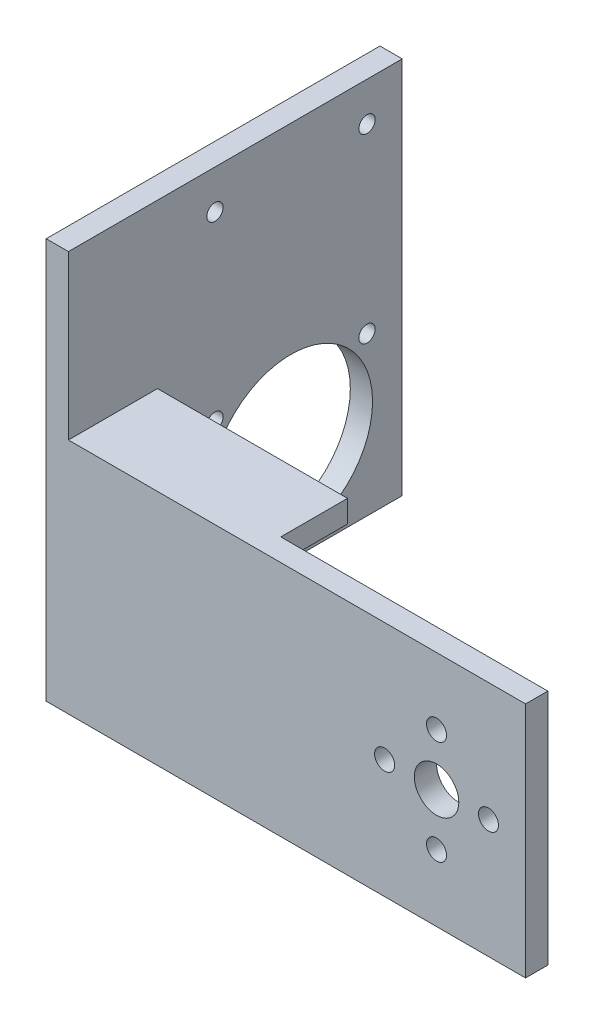
from build123d import *

# Parameters (mm, degrees)
S_BOX1_W      = 64.625
S_BOX1_H      = 32
BOSS_1_DEPTH  = 3
S_BOX2_W      = 3
S_BOX2_H      = 51
BOSS_2_DEPTH  = 45
S_BOX3_W      = 26.125
S_BOX3_H      = 3
BOSS_3_DEPTH  = 11.5
S_BOX4_W      = 26.125
S_BOX4_H      = 3
BOSS_4_DEPTH  = 11.5
S_HOLE5_R     = 3
HOLE_5_DEPTH  = 3.2
S_HOLE6_R     = 1.35
HOLE_6_DEPTH  = 3.2
S_HOLE7_R     = 1.35
HOLE_7_DEPTH  = 3.2
S_HOLE8_R     = 1.35
HOLE_8_DEPTH  = 3.2
S_HOLE9_R     = 1.35
HOLE_9_DEPTH  = 3.2
S_HOLE10_R    = 11
HOLE_10_DEPTH = 3.2
S_HOLE11_R    = 1.1
HOLE_11_DEPTH = 3.2
S_HOLE12_R    = 1.1
HOLE_12_DEPTH = 3.2
S_HOLE13_R    = 1.1
HOLE_13_DEPTH = 3.2
S_HOLE14_R    = 1.1
HOLE_14_DEPTH = 3.2


with BuildPart() as part:
    # S_box1 → Boss_1 (new body)
    with BuildSketch(Plane.XY.offset(27)):
        with Locations((-20.3125, 0)):
            Rectangle(S_BOX1_W, S_BOX1_H)
    extrude(amount=BOSS_1_DEPTH)

    # S_box2 → Boss_2 (add)
    with BuildSketch(Plane.XY.offset(-15)):
        with Locations((-51.125, 12.5)):
            Rectangle(S_BOX2_W, S_BOX2_H)
    extrude(amount=BOSS_2_DEPTH)

    # S_box3 → Boss_3 (add)
    with BuildSketch(Plane.XY.offset(18)):
        with Locations((-37.0625, -12)):
            Rectangle(S_BOX3_W, S_BOX3_H)
    extrude(amount=BOSS_3_DEPTH)

    # S_box4 → Boss_4 (add)
    with BuildSketch(Plane.XY.offset(18)):
        with Locations((-37.0625, 14.5)):
            Rectangle(S_BOX4_W, S_BOX4_H)
    extrude(amount=BOSS_4_DEPTH)

    # S_hole5 → Hole_5 (cut)
    with BuildSketch(Plane.XY.offset(26.9)):
        Circle(S_HOLE5_R)
    extrude(amount=HOLE_5_DEPTH, mode=Mode.SUBTRACT)

    # S_hole6 → Hole_6 (cut)
    with BuildSketch(Plane.XY.offset(26.9)):
        with Locations((7, 0)):
            Circle(S_HOLE6_R)
    extrude(amount=HOLE_6_DEPTH, mode=Mode.SUBTRACT)

    # S_hole7 → Hole_7 (cut)
    with BuildSketch(Plane.XY.offset(26.9)):
        with Locations((0, -7)):
            Circle(S_HOLE7_R)
    extrude(amount=HOLE_7_DEPTH, mode=Mode.SUBTRACT)

    # S_hole8 → Hole_8 (cut)
    with BuildSketch(Plane.XY.offset(26.9)):
        with Locations((-7, 0)):
            Circle(S_HOLE8_R)
    extrude(amount=HOLE_8_DEPTH, mode=Mode.SUBTRACT)

    # S_hole9 → Hole_9 (cut)
    with BuildSketch(Plane.XY.offset(26.9)):
        with Locations((0, 7)):
            Circle(S_HOLE9_R)
    extrude(amount=HOLE_9_DEPTH, mode=Mode.SUBTRACT)

    # S_hole10 → Hole_10 (cut)
    with BuildSketch(Plane(origin=(-52.725, 0, 0), x_dir=(0, 0, -1), z_dir=(1, 0, 0))):
        Circle(S_HOLE10_R)
    extrude(amount=HOLE_10_DEPTH, mode=Mode.SUBTRACT)

    # S_hole11 → Hole_11 (cut)
    with BuildSketch(Plane(origin=(-52.725, 0, 0), x_dir=(0, 0, -1), z_dir=(1, 0, 0))):
        with Locations((10.25, 8.3)):
            Circle(S_HOLE11_R)
    extrude(amount=HOLE_11_DEPTH, mode=Mode.SUBTRACT)

    # S_hole12 → Hole_12 (cut)
    with BuildSketch(Plane(origin=(-52.725, 0, 0), x_dir=(0, 0, -1), z_dir=(1, 0, 0))):
        with Locations((-10.25, 8.3)):
            Circle(S_HOLE12_R)
    extrude(amount=HOLE_12_DEPTH, mode=Mode.SUBTRACT)

    # S_hole13 → Hole_13 (cut)
    with BuildSketch(Plane(origin=(-52.725, 0, 0), x_dir=(0, 0, -1), z_dir=(1, 0, 0))):
        with Locations((10.25, 32.75)):
            Circle(S_HOLE13_R)
    extrude(amount=HOLE_13_DEPTH, mode=Mode.SUBTRACT)

    # S_hole14 → Hole_14 (cut)
    with BuildSketch(Plane(origin=(-52.725, 0, 0), x_dir=(0, 0, -1), z_dir=(1, 0, 0))):
        with Locations((-10.25, 32.75)):
            Circle(S_HOLE14_R)
    extrude(amount=HOLE_14_DEPTH, mode=Mode.SUBTRACT)


solid = part.part
